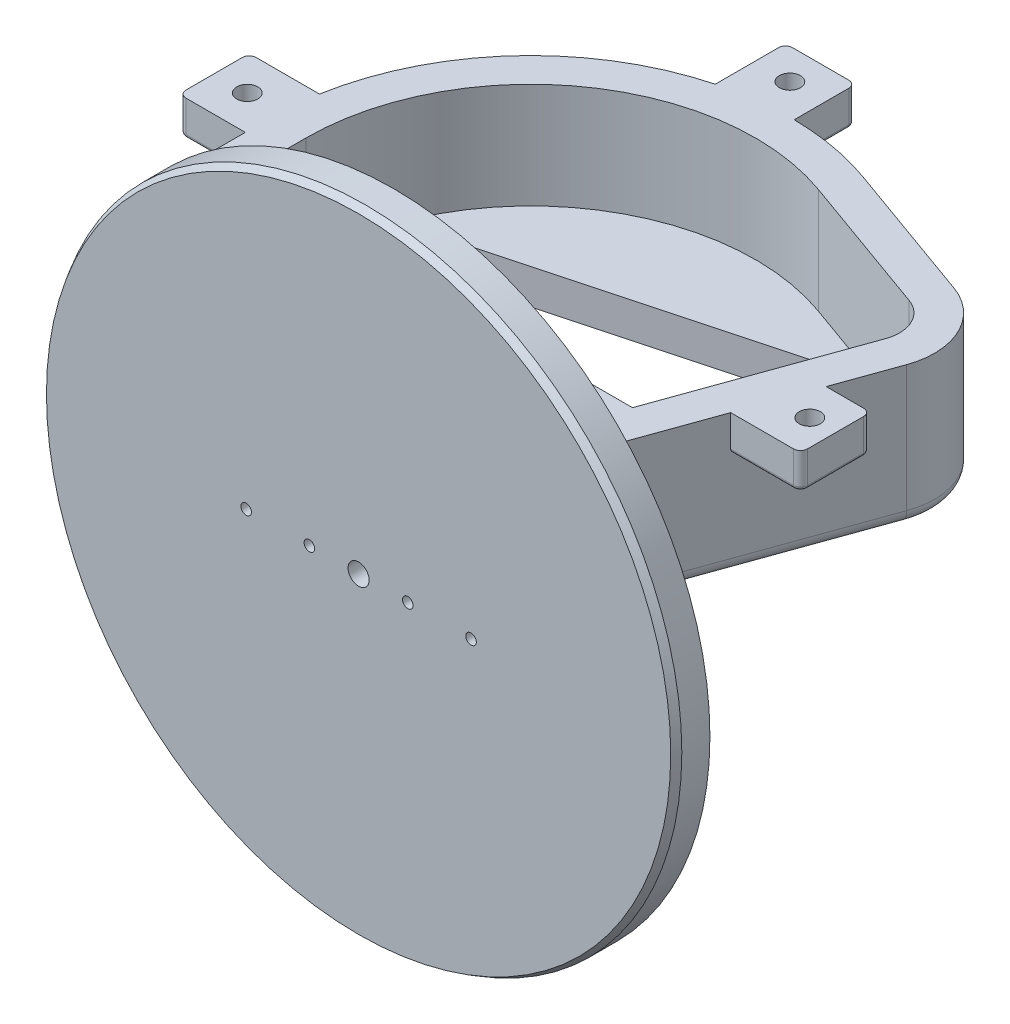
from build123d import *

# Parameters (mm, degrees)
ESQUISSE1_R             = 45
ESQUISSE1_R_2           = 1.5
ESQUISSE1_R_3           = 0.75
BOSS_EXTRU_1_DEPTH      = 5
BOSS_EXTRU_2_START      = 10
BOSS_EXTRU_2_DEPTH      = 20
ENL_V_MAT_EXTRU_1_DEPTH = 15
ENL_V_MAT_EXTRU_2_DEPTH = 15
ESQUISSE5_R             = 2.2
ENL_V_MAT_EXTRU_3_DEPTH = 15
CHANFREIN1_SIZE         = 1
CHANFREIN1_SIZE2        = 0.577350269
BOSS_EXTRU_3_START      = -5
ESQUISSE6_R             = 1.5
BOSS_EXTRU_3_DEPTH      = 5
CONG_VARIABLE2_R        = 2
CONG_2_R                = 0.5


with BuildPart() as part:
    # Esquisse1 → Boss.-Extru.1 (new body)
    with BuildSketch(Plane.XY):
        Circle(ESQUISSE1_R)
        Circle(ESQUISSE1_R_2, mode=Mode.SUBTRACT)
        with Locations((7, 0)):
            Circle(ESQUISSE1_R_3, mode=Mode.SUBTRACT)
        with Locations((16, 0)):
            Circle(ESQUISSE1_R_3, mode=Mode.SUBTRACT)
        with Locations((-16, 0)):
            Circle(ESQUISSE1_R_3, mode=Mode.SUBTRACT)
        with Locations((-7, 0)):
            Circle(ESQUISSE1_R_3, mode=Mode.SUBTRACT)
    extrude(amount=BOSS_EXTRU_1_DEPTH)

    # Esquisse2 → Boss.-Extru.2 (add)
    with BuildSketch(Plane(origin=(0, 0, 0), x_dir=(1, 0, 0), z_dir=(0, 1, 0)).offset(BOSS_EXTRU_2_START)):
        with BuildLine():
            Line((32.5, 0), (-32.5, 0))
            Line((-32.5, 0), (-32.5, 15))
            ThreePointArc((-32.5, 15), (-16.798139101, 45.255400688), (16.980501125, 49.831553104))
            Line((16.980501125, 49.831553104), (37.143899579, 42.60680156))
            ThreePointArc((37.143899579, 42.60680156), (42.812595053, 37.46437651), (43.184724439, 29.819759876))
            Line((43.184724439, 29.819759876), (32.5, 0))
        make_face()
    extrude(amount=BOSS_EXTRU_2_DEPTH)

    # Esquisse3 → Enlèv. mat.-Extru.1 (cut)
    with BuildSketch(Plane(origin=(0, 30, 0), x_dir=(1, 0, 0), z_dir=(0, 1, 0))):
        with BuildLine():
            ThreePointArc((15.293946919, 45.124586469), (-13.920012196, 41.166833028), (-27.5, 15))
            Line((-27.5, 15), (-27.5, 5))
            Line((-27.5, 5), (28.980274824, 5))
            Line((28.980274824, 5), (38.477757803, 31.506314082))
            ThreePointArc((38.477757803, 31.506314082), (38.29169311, 35.328622399), (35.457345373, 37.899834924))
            Line((35.457345373, 37.899834924), (15.293946919, 45.124586469))
        make_face()
    extrude(amount=-ENL_V_MAT_EXTRU_1_DEPTH, mode=Mode.SUBTRACT)

    # Esquisse4 → Enlèv. mat.-Extru.2 (cut)
    with BuildSketch(Plane.XZ.offset(-10)):
        Polygon((-13.170422543, -8.380092045), (25.852980839, -18.836381467), (20.573072319, -38.541268323), (-18.450331063, -28.084978901), align=None)
    extrude(amount=-ENL_V_MAT_EXTRU_2_DEPTH, mode=Mode.SUBTRACT)

    # Esquisse5 → Enlèv. mat.-Extru.3 (cut)
    with BuildSketch(Plane(origin=(0, 15, 0), x_dir=(1, 0, 0), z_dir=(0, 1, 0))):
        with Locations((-18.911244087, 12.225279687)):
            Circle(ESQUISSE5_R)
        with Locations((-21.499434538, 21.884537949)):
            Circle(ESQUISSE5_R)
        with Locations((28.902084314, 25.036822419)):
            Circle(ESQUISSE5_R)
        with Locations((26.313893863, 34.696080682)):
            Circle(ESQUISSE5_R)
    extrude(amount=-ENL_V_MAT_EXTRU_3_DEPTH, mode=Mode.SUBTRACT)

    # Chanfrein1
    chanfrein1_edges = [part.edges().sort_by_distance(p)[0] for p in [
        (-45, 0, 5),
    ]]
    chanfrein1_side = [part.faces().sort_by_distance(p)[0] for p in [
        (-45, 0, 2.5),
    ]]
    chamfer(chanfrein1_edges, length=CHANFREIN1_SIZE, length2=CHANFREIN1_SIZE2, reference=chanfrein1_side[0])

    # Esquisse6 → Boss.-Extru.3 (add)
    # profile 1 of 3: a face of its own
    with BuildSketch(Plane(origin=(0, 30, 0), x_dir=(1, 0, 0), z_dir=(0, 1, 0)).offset(BOSS_EXTRU_3_START)):
        with BuildLine():
            ThreePointArc((-4, 60.759614092), (-4.707106781, 60.466720873), (-5, 59.759614092))
            Line((-5, 59.759614092), (-5, 50.759614092))
            ThreePointArc((-5, 50.759614092), (-0.042306332, 51.720123273), (5, 51.996621467))
            Line((5, 51.996621467), (5, 59.759614092))
            ThreePointArc((5, 59.759614092), (4.707106781, 60.466720873), (4, 60.759614092))
            Line((4, 60.759614092), (-4, 60.759614092))
        make_face()
        with Locations((0, 56.37811778)):
            Circle(ESQUISSE6_R, mode=Mode.SUBTRACT)
    # profile 2 of 3: a face of its own
    with BuildSketch(Plane(origin=(0, 30, 0), x_dir=(1, 0, 0), z_dir=(0, 1, 0)).offset(BOSS_EXTRU_3_START)):
        with BuildLine():
            ThreePointArc((-32.5, 15), (-32.361195554, 18.201915417), (-31.945823657, 21.379807046))
            Line((-31.945823657, 21.379807046), (-40.945823657, 21.379807046))
            ThreePointArc((-40.945823657, 21.379807046), (-41.652930438, 21.086913827), (-41.945823657, 20.379807046))
            Line((-41.945823657, 20.379807046), (-41.945823657, 12.379807046))
            ThreePointArc((-41.945823657, 12.379807046), (-41.652930438, 11.672700265), (-40.945823657, 11.379807046))
            Line((-40.945823657, 11.379807046), (-32.5, 11.379807046))
            Line((-32.5, 11.379807046), (-32.5, 15))
        make_face()
        with Locations((-37.222911829, 16.379807046)):
            Circle(ESQUISSE6_R, mode=Mode.SUBTRACT)
    # profile 3 of 3: a face of its own
    with BuildSketch(Plane(origin=(0, 30, 0), x_dir=(1, 0, 0), z_dir=(0, 1, 0)).offset(BOSS_EXTRU_3_START)):
        with BuildLine():
            Line((45.5081781, 21.379807046), (40.160603163, 21.379807046))
            Line((40.160603163, 21.379807046), (36.577501058, 11.379807046))
            Line((36.577501058, 11.379807046), (45.5081781, 11.379807046))
            ThreePointArc((45.5081781, 11.379807046), (46.215284881, 11.672700265), (46.5081781, 12.379807046))
            Line((46.5081781, 12.379807046), (46.5081781, 20.379807046))
            ThreePointArc((46.5081781, 20.379807046), (46.215284881, 21.086913827), (45.5081781, 21.379807046))
        make_face()
        with Locations((42.834390632, 16.379807046)):
            Circle(ESQUISSE6_R, mode=Mode.SUBTRACT)
    extrude(amount=BOSS_EXTRU_3_DEPTH)

    # Congé variable2
    cong_variable2_edges = [part.edges().sort_by_distance(p)[0] for p in [
        (27.062200352, 10, -46.219177332),
    ]]
    fillet(cong_variable2_edges, radius=CONG_VARIABLE2_R)

    # Congé2
    cong_2_edges = [part.edges().sort_by_distance(p)[0] for p in [
        (42.834390632, 25, -21.379807046),
        (46.215284881, 25, -21.086913827),
        (46.5081781, 25, -16.379807046),
        (46.215284881, 25, -11.672700265),
        (-36.722911829, 25, -11.379807046),
        (-41.652930438, 25, -11.672700265),
        (-41.945823657, 25, -16.379807046),
        (-41.652930438, 25, -21.086913827),
        (5, 25, -55.87811778),
        (4.707106781, 25, -60.466720873),
        (0, 25, -60.759614092),
        (-4.707106781, 25, -60.466720873),
        (41.042839579, 25, -11.379807046),
        (-36.445823657, 25, -21.379807046),
        (-5, 25, -55.259614092),
    ]]
    fillet(cong_2_edges, radius=CONG_2_R)


solid = part.part
